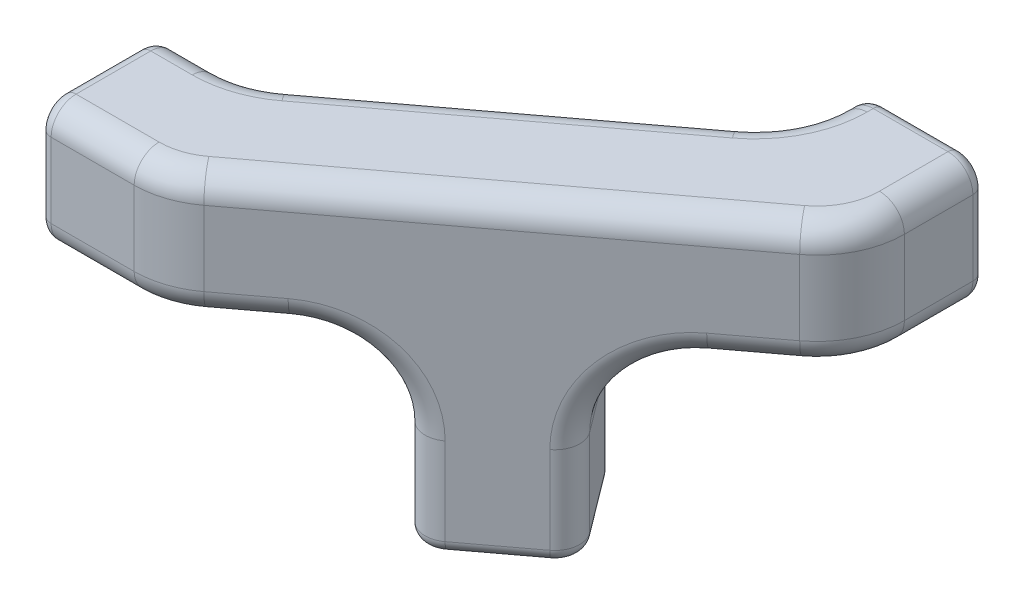
from build123d import *

# Parameters (mm, degrees)
BOSS_EXTRUDE1_DEPTH = 10
BOSS_EXTRUDE2_DEPTH = 15
SKETCH4_R           = 2.4999999999999942
CUT_EXTRUDE1_DEPTH  = 10
SKETCH5_R           = 2.4999999999999956
CUT_EXTRUDE2_DEPTH  = 10
SKETCH6_R           = 2.5000000000000093
CUT_EXTRUDE3_DEPTH  = 10
CHAMFER1_SIZE       = 0.7
FILLET1_R           = 7
FILLET2_R           = 1
FILLET3_R           = 2


with BuildPart() as part:
    # Sketch2 → Boss-Extrude1 (new body)
    with BuildSketch(Plane(origin=(0, 0, 0), x_dir=(1, 0, 0), z_dir=(0, 1, 0))):
        Polygon((-110.24999999999997, 168), (-103.5833333333333, 168), (-78.25, 187), (-78.25, 192), (-68.24999999999999, 192), (-68.24999999999999, 182), (-100.24999999999997, 158), (-110.24999999999997, 158), align=None)
    extrude(amount=BOSS_EXTRUDE1_DEPTH)

    # Sketch3 → Boss-Extrude2 (add)
    with BuildSketch(Plane.XZ):
        Polygon((-94.91666666666667, -174.5), (-88.91666666666667, -166.49999999999997), (-80.91666666666664, -172.50000000000003), (-86.91666666666663, -180.50000000000003), align=None)
    extrude(amount=BOSS_EXTRUDE2_DEPTH)

    # Sketch4 → Cut-Extrude1 (cut)
    with BuildSketch(Plane(origin=(0, 0, -192), x_dir=(-1, 0, 0), z_dir=(0, 0, -1))):
        with Locations((73.25, 5)):
            Circle(SKETCH4_R)
    extrude(amount=-CUT_EXTRUDE1_DEPTH, mode=Mode.SUBTRACT)

    # Sketch5 → Cut-Extrude2 (cut)
    with BuildSketch(Plane.ZY.offset(110.24999999999997)):
        with Locations((-163, 5)):
            Circle(SKETCH5_R)
    extrude(amount=-CUT_EXTRUDE2_DEPTH, mode=Mode.SUBTRACT)

    # Sketch6 → Cut-Extrude3 (cut)
    with BuildSketch(Plane.XZ.offset(15)):
        with Locations(Location((-87.91666666666666, -173.5, 0), (0, 0, 270))):
            Circle(SKETCH6_R)
    extrude(amount=-CUT_EXTRUDE3_DEPTH, mode=Mode.SUBTRACT)

    # Chamfer1
    chamfer1_edges = [part.edges().sort_by_distance(p)[0] for p in [
        (-70.75, 5, -192),
        (-110.24999999999997, 5, -165.5),
        (-87.91666666666666, -15, -171),
    ]]
    chamfer(chamfer1_edges, length=CHAMFER1_SIZE)

    # Fillet1
    fillet1_edges = [part.edges().sort_by_distance(p)[0] for p in [
        (-103.5833333333333, 5, -168),
        (-78.25, 5, -187),
        (-68.24999999999999, 5, -182),
        (-100.24999999999997, 5, -158),
        (-83.91666666666663, 0, -176.50000000000003),
        (-91.91666666666667, 0, -170.5),
    ]]
    fillet(fillet1_edges, radius=FILLET1_R)

    # Fillet2
    fillet2_edges = [part.edges().sort_by_distance(p)[0] for p in [
        (-110.24999999999997, 0, -163),
        (-110.24999999999997, 5, -168),
        (-78.25, 5, -192),
        (-68.24999999999999, 5, -192),
        (-110.24999999999997, 5, -158),
        (-73.25, 10, -192),
        (-90.91666666666666, -15, -177.5),
        (-83.91666666666663, -15, -176.50000000000003),
        (-84.91666666666666, -15, -169.5),
        (-91.91666666666667, -15, -170.5),
        (-110.24999999999997, 10, -163),
        (-73.25, 0, -192),
    ]]
    fillet(fillet2_edges, radius=FILLET2_R)

    # Fillet3
    # the kernel refuses this fillet: 2 mm, written as the material it takes off along each edge
    with BuildSketch(Plane(origin=(-110.24999999999997, 8, -166), x_dir=(0, 1, 0), z_dir=(0, 0, 1))) as fillet3_piece_1:
        with BuildLine():
            CenterArc((1, -1), 1, 0, 90)
            Line((2, -1), (2, 0))
            Line((2, 0), (1, 0))
        make_face()
    revolve(axis=Axis((-110.24999999999997, 8, -166), (-1, 0, 0)), revolution_arc=90, mode=Mode.SUBTRACT)
    with BuildSketch(Plane(origin=(-110.24999999999997, 2, -166), x_dir=(0, 0, -1), z_dir=(0, 1, 0))) as fillet3_piece_2:
        with BuildLine():
            CenterArc((1, -1), 1, 0, 90)
            Line((2, -1), (2, 0))
            Line((2, 0), (1, 0))
        make_face()
    revolve(axis=Axis((-110.24999999999997, 2, -166), (-1, 0, 0)), revolution_arc=90, mode=Mode.SUBTRACT)
    with BuildSketch(Plane(origin=(-110.24999999999997, 8, -160), x_dir=(0, 0, 1), z_dir=(0, -1, 0))) as fillet3_piece_3:
        with BuildLine():
            CenterArc((1, -1), 1, 0, 90)
            Line((2, -1), (2, 0))
            Line((2, 0), (1, 0))
        make_face()
    revolve(axis=Axis((-110.24999999999997, 8, -160), (-1, 0, 0)), revolution_arc=90, mode=Mode.SUBTRACT)
    with BuildSketch(Plane(origin=(-110.24999999999997, 1.9999999999999998, -160), x_dir=(0, -1, 0), z_dir=(0, 0, -1))) as fillet3_piece_4:
        with BuildLine():
            CenterArc((1, -1), 1, 0, 90)
            Line((2, -1), (2, 0))
            Line((2, 0), (1, 0))
        make_face()
    revolve(axis=Axis((-110.24999999999997, 1.9999999999999998, -160), (-1, 0, 0)), revolution_arc=90, mode=Mode.SUBTRACT)
    with BuildSketch(Plane(origin=(-76.25, 8, -192), x_dir=(-1, 0, 0), z_dir=(0, -1, 0))) as fillet3_piece_5:
        with BuildLine():
            CenterArc((1, -1), 1, 0, 90)
            Line((2, -1), (2, 0))
            Line((2, 0), (1, 0))
        make_face()
    revolve(axis=Axis((-76.25, 8, -192), (0, 0, -1)), revolution_arc=90, mode=Mode.SUBTRACT)
    with BuildSketch(Plane(origin=(-76.25, 1.9999999999999998, -192), x_dir=(0, -1, 0), z_dir=(1, 0, 0))) as fillet3_piece_6:
        with BuildLine():
            CenterArc((1, -1), 1, 0, 90)
            Line((2, -1), (2, 0))
            Line((2, 0), (1, 0))
        make_face()
    revolve(axis=Axis((-76.25, 1.9999999999999998, -192), (0, 0, -1)), revolution_arc=90, mode=Mode.SUBTRACT)
    with BuildSketch(Plane(origin=(-70.24999999999999, 8, -192), x_dir=(0, 1, 0), z_dir=(-1, 0, 0))) as fillet3_piece_7:
        with BuildLine():
            CenterArc((1, -1), 1, 0, 90)
            Line((2, -1), (2, 0))
            Line((2, 0), (1, 0))
        make_face()
    revolve(axis=Axis((-70.24999999999999, 8, -192), (0, 0, -1)), revolution_arc=90, mode=Mode.SUBTRACT)
    with BuildSketch(Plane(origin=(-70.24999999999999, 1.9999999999999998, -192), x_dir=(1, 0, 0), z_dir=(0, 1, 0))) as fillet3_piece_8:
        with BuildLine():
            CenterArc((1, -1), 1, 0, 90)
            Line((2, -1), (2, 0))
            Line((2, 0), (1, 0))
        make_face()
    revolve(axis=Axis((-70.24999999999999, 1.9999999999999998, -192), (0, 0, -1)), revolution_arc=90, mode=Mode.SUBTRACT)
    with BuildSketch(Plane(origin=(-87.31666666666665, -15, -177.70000000000002), x_dir=(-0.6000000000000005, 0, -0.7999999999999996), z_dir=(-0.7999999999999996, 0, 0.6000000000000005))) as fillet3_piece_9:
        with BuildLine():
            CenterArc((1, -1), 1, 0, 90)
            Line((2, -1), (2, 0))
            Line((2, 0), (1, 0))
        make_face()
    revolve(axis=Axis((-87.31666666666665, -15, -177.70000000000002), (0, -1, 0)), revolution_arc=90.00000000000011, mode=Mode.SUBTRACT)
    with BuildSketch(Plane(origin=(-92.11666666666667, -15, -174.1), x_dir=(-0.800000000000001, 0, 0.5999999999999986), z_dir=(0.5999999999999986, 0, 0.800000000000001))) as fillet3_piece_10:
        with BuildLine():
            CenterArc((1, -1), 1, 0, 90)
            Line((2, -1), (2, 0))
            Line((2, 0), (1, 0))
        make_face()
    revolve(axis=Axis((-92.11666666666667, -15, -174.1), (0, -1, 0)), revolution_arc=89.99999999999987, mode=Mode.SUBTRACT)
    with BuildSketch(Plane(origin=(-83.71666666666663, -15, -172.9), x_dir=(0.8000000000000007, 0, -0.5999999999999991), z_dir=(-0.5999999999999991, 0, -0.8000000000000007))) as fillet3_piece_11:
        with BuildLine():
            CenterArc((1, -1), 1, 0, 90)
            Line((2, -1), (2, 0))
            Line((2, 0), (1, 0))
        make_face()
    revolve(axis=Axis((-83.71666666666663, -15, -172.9), (0, -1, 0)), revolution_arc=89.99999999999993, mode=Mode.SUBTRACT)
    with BuildSketch(Plane(origin=(-88.51666666666665, -15, -169.29999999999998), x_dir=(0.6000000000000002, 0, 0.7999999999999999), z_dir=(0.7999999999999999, 0, -0.6000000000000002))) as fillet3_piece_12:
        with BuildLine():
            CenterArc((1, -1), 1, 0, 90)
            Line((2, -1), (2, 0))
            Line((2, 0), (1, 0))
        make_face()
    revolve(axis=Axis((-88.51666666666665, -15, -169.29999999999998), (0, -1, 0)), revolution_arc=90.00000000000011, mode=Mode.SUBTRACT)
    with BuildSketch(Plane(origin=(-102.5833333333333, 0, -158), x_dir=(0, 1, 0), z_dir=(-1, 0, 0))) as fillet3_piece_13:
        with BuildLine():
            CenterArc((FILLET3_R, FILLET3_R), FILLET3_R, 180, 90)
            Line((-2.2e-16, FILLET3_R), (0, 0))
            Line((0, 0), (FILLET3_R, 0))
        make_face()
    extrude(amount=7.666666666666671, mode=Mode.SUBTRACT)
    with BuildSketch(Plane(origin=(-102.5833333333333, 10, -158), x_dir=(0, -1, 0), z_dir=(-1, 0, 0))) as fillet3_piece_14:
        with BuildLine():
            CenterArc((FILLET3_R, -FILLET3_R), FILLET3_R, 90, 90)
            Line((0, -FILLET3_R), (0, 0))
            Line((0, 0), (FILLET3_R, 0))
        make_face()
    extrude(amount=7.666666666666671, mode=Mode.SUBTRACT)
    with BuildSketch(Plane(origin=(-78.25, 10, -190.5), x_dir=(1, 0, 0), z_dir=(0, 0, -1))) as fillet3_piece_15:
        with BuildLine():
            CenterArc((FILLET3_R, FILLET3_R), FILLET3_R, 180, 90)
            Line((0, FILLET3_R), (0, 0))
            Line((0, 0), (FILLET3_R, 0))
        make_face()
    extrude(amount=1.5, mode=Mode.SUBTRACT)
    with BuildSketch(Plane(origin=(-78.25, 0, -190.5), x_dir=(0, 1, 0), z_dir=(0, 0, -1))) as fillet3_piece_16:
        with BuildLine():
            CenterArc((FILLET3_R, FILLET3_R), FILLET3_R, 180, 90)
            Line((-2.2e-16, FILLET3_R), (0, 0))
            Line((0, 0), (FILLET3_R, 0))
        make_face()
    extrude(amount=1.5, mode=Mode.SUBTRACT)
    with BuildSketch(Plane(origin=(-88.91666666666667, -6.999999999999999, -166.49999999999997), x_dir=(0.8, 0, -0.6), z_dir=(0, -1, 0))) as fillet3_piece_17:
        with BuildLine():
            CenterArc((FILLET3_R, -FILLET3_R), FILLET3_R, 89.99999999999983, 89.99999999999969)
            Line((1.702e-14, -FILLET3_R), (0, 0))
            Line((0, 0), (FILLET3_R, -8e-17))
        make_face()
    extrude(amount=8, mode=Mode.SUBTRACT)
    with BuildSketch(Plane(origin=(-80.91666666666664, -6.999999999999999, -172.50000000000003), x_dir=(-0.7999999999999924, 0, 0.6000000000000103), z_dir=(0, -1, 0))) as fillet3_piece_18:
        with BuildLine():
            CenterArc((FILLET3_R, FILLET3_R), FILLET3_R, 180, 90.00000000000057)
            Line((-1.999e-14, FILLET3_R), (0, 0))
            Line((0, 0), (FILLET3_R, 1e-17))
        make_face()
    extrude(amount=8, mode=Mode.SUBTRACT)
    with BuildSketch(Plane(origin=(-94.91666666666667, -6.999999999999999, -174.5), x_dir=(0.8000000000000017, 0, -0.5999999999999978), z_dir=(0, -1, 0))) as fillet3_piece_19:
        with BuildLine():
            CenterArc((FILLET3_R, FILLET3_R), FILLET3_R, 180.00000000000023, 89.99999999999943)
            Line((-3e-17, FILLET3_R), (0, 0))
            Line((0, 0), (FILLET3_R, 1e-17))
        make_face()
    extrude(amount=8, mode=Mode.SUBTRACT)
    with BuildSketch(Plane(origin=(-86.91666666666663, -6.999999999999999, -180.50000000000003), x_dir=(-0.8, 0, 0.6), z_dir=(0, -1, 0))) as fillet3_piece_20:
        with BuildLine():
            CenterArc((FILLET3_R, -FILLET3_R), FILLET3_R, 89.99999999999983, 90.0000000000008)
            Line((1.131e-14, -FILLET3_R), (0, 0))
            Line((0, 0), (FILLET3_R, -8e-17))
        make_face()
    extrude(amount=8, mode=Mode.SUBTRACT)
    with BuildSketch(Plane(origin=(-68.24999999999999, 0, -192), x_dir=(0, 1, 0), z_dir=(0, 0, 1))) as fillet3_piece_21:
        with BuildLine():
            CenterArc((FILLET3_R, FILLET3_R), FILLET3_R, 180, 90)
            Line((-2.2e-16, FILLET3_R), (0, 0))
            Line((0, 0), (FILLET3_R, 0))
        make_face()
    extrude(amount=6.5, mode=Mode.SUBTRACT)
    with BuildSketch(Plane(origin=(-68.24999999999999, 10, -192), x_dir=(-1, 0, 0), z_dir=(0, 0, 1))) as fillet3_piece_22:
        with BuildLine():
            CenterArc((FILLET3_R, FILLET3_R), FILLET3_R, 180, 90)
            Line((0, FILLET3_R), (0, 0))
            Line((0, 0), (FILLET3_R, 0))
        make_face()
    extrude(amount=6.5, mode=Mode.SUBTRACT)
    with BuildSketch(Plane(origin=(-81.31666666666663, 0, -184.70000000000002), x_dir=(0, 1, 0), z_dir=(0.7999999999999996, 0, -0.6000000000000005))) as fillet3_piece_23:
        with BuildLine():
            CenterArc((FILLET3_R, FILLET3_R), FILLET3_R, 180, 90)
            Line((-2.2e-16, FILLET3_R), (0, 0))
            Line((0, 0), (FILLET3_R, 0))
        make_face()
    extrude(amount=0.333333333333303, mode=Mode.SUBTRACT)
    with BuildSketch(Plane(origin=(-71.04999999999998, 0, -179.9), x_dir=(2.56e-15, 1, 3.41e-15), z_dir=(-0.7999999999999999, 0, 0.6000000000000002))) as fillet3_piece_24:
        with BuildLine():
            CenterArc((FILLET3_R, FILLET3_R), FILLET3_R, 180, 90.00000000000023)
            Line((-8.75e-15, FILLET3_R), (0, 0))
            Line((0, 0), (FILLET3_R, 0))
        make_face()
    extrude(amount=5.333333333333315, mode=Mode.SUBTRACT)
    with BuildSketch(Plane(origin=(-75.24999999999999, 0, -185.5), x_dir=(0.6000000000000006, 0, 0.7999999999999995), z_dir=(-0.7999999999999995, 0, 0.6000000000000006))) as fillet3_piece_25:
        with BuildLine():
            CenterArc((6.999999999999997 - FILLET3_R, FILLET3_R), FILLET3_R, 270, 90)
            Line((6.999999999999997 - FILLET3_R, -2.2e-16), (6.999999999999997, 0))
            Line((6.999999999999997, 0), (6.999999999999997, FILLET3_R))
        make_face()
    revolve(axis=Axis((-75.24999999999999, 0, -185.5), (0, 1, 0)), revolution_arc=53.13010235415593, mode=Mode.SUBTRACT)
    with BuildSketch(Plane(origin=(-94.51666666666668, 0, -162.29999999999998), x_dir=(-0.6000000000000002, 0, -0.7999999999999998), z_dir=(-0.7999999999999999, 0, 0.6000000000000002))) as fillet3_piece_26:
        with BuildLine():
            CenterArc((FILLET3_R, -FILLET3_R), FILLET3_R, 90, 90)
            Line((0, -FILLET3_R), (0, 0))
            Line((0, 0), (FILLET3_R, 0))
        make_face()
    extrude(amount=4.833333333333281, mode=Mode.SUBTRACT)
    with BuildSketch(Plane(origin=(-71.04999999999998, 10, -179.9), x_dir=(-0.6000000000000002, 0, -0.7999999999999998), z_dir=(-0.7999999999999999, 0, 0.6000000000000002))) as fillet3_piece_27:
        with BuildLine():
            CenterArc((FILLET3_R, FILLET3_R), FILLET3_R, 180, 90)
            Line((-8.53e-15, FILLET3_R), (0, 0))
            Line((0, 0), (FILLET3_R, 0))
        make_face()
    extrude(amount=34.16666666666665, mode=Mode.SUBTRACT)
    with BuildSketch(Plane(origin=(-101.71666666666664, 10, -169.4), x_dir=(0.6000000000000005, 0, 0.7999999999999996), z_dir=(0.7999999999999996, 0, -0.6000000000000005))) as fillet3_piece_28:
        with BuildLine():
            CenterArc((FILLET3_R, FILLET3_R), FILLET3_R, 180, 90)
            Line((0, FILLET3_R), (0, 0))
            Line((0, 0), (FILLET3_R, 0))
        make_face()
    extrude(amount=25.833333333333314, mode=Mode.SUBTRACT)
    with BuildSketch(Plane(origin=(-110.24999999999997, 10, -168), x_dir=(0, 0, 1), z_dir=(1, 0, 0))) as fillet3_piece_29:
        with BuildLine():
            CenterArc((FILLET3_R, FILLET3_R), FILLET3_R, 180, 90)
            Line((0, FILLET3_R), (0, 0))
            Line((0, 0), (FILLET3_R, 0))
        make_face()
    extrude(amount=4.333333333333314, mode=Mode.SUBTRACT)
    with BuildSketch(Plane(origin=(-102.5833333333333, 10, -165), x_dir=(0, 0, 1), z_dir=(-1, 0, 0))) as fillet3_piece_30:
        with BuildLine():
            CenterArc((7 - FILLET3_R, -FILLET3_R), FILLET3_R, 0, 90)
            Line((7 - FILLET3_R, 0), (7, 0))
            Line((7, 0), (7, -FILLET3_R))
        make_face()
    revolve(axis=Axis((-102.5833333333333, 10, -165), (0, 1, 0)), revolution_arc=36.86989764584407, mode=Mode.SUBTRACT)
    with BuildSketch(Plane(origin=(-75.24999999999999, 10, -185.5), x_dir=(0.6000000000000006, 0, 0.7999999999999995), z_dir=(-0.7999999999999995, 0, 0.6000000000000006))) as fillet3_piece_31:
        with BuildLine():
            CenterArc((6.999999999999997 - FILLET3_R, -FILLET3_R), FILLET3_R, 0, 90)
            Line((6.999999999999997, -FILLET3_R), (6.999999999999997, 0))
            Line((6.999999999999997, 0), (6.999999999999997 - FILLET3_R, 0))
        make_face()
    revolve(axis=Axis((-75.24999999999999, 10, -185.5), (0, 1, 0)), revolution_arc=53.13010235415593, mode=Mode.SUBTRACT)
    with BuildSketch(Plane(origin=(-101.71666666666664, 0, -169.4), x_dir=(0.6000000000000005, 0, 0.7999999999999996), z_dir=(0.7999999999999996, 0, -0.6000000000000005))) as fillet3_piece_32:
        with BuildLine():
            CenterArc((FILLET3_R, -FILLET3_R), FILLET3_R, 90, 90)
            Line((0, -FILLET3_R), (0, 0))
            Line((0, 0), (FILLET3_R, 0))
        make_face()
    extrude(amount=1.499999999999966, mode=Mode.SUBTRACT)
    with BuildSketch(Plane(origin=(-110.24999999999997, 0, -168), x_dir=(0, 0, 1), z_dir=(1, 0, 0))) as fillet3_piece_33:
        with BuildLine():
            CenterArc((FILLET3_R, -FILLET3_R), FILLET3_R, 90, 90)
            Line((0, -FILLET3_R), (0, 0))
            Line((0, 0), (FILLET3_R, 0))
        make_face()
    extrude(amount=4.333333333333314, mode=Mode.SUBTRACT)
    with BuildSketch(Plane(origin=(-102.5833333333333, 0, -165), x_dir=(0, 0, 1), z_dir=(-1, 0, 0))) as fillet3_piece_34:
        with BuildLine():
            CenterArc((7 - FILLET3_R, FILLET3_R), FILLET3_R, 270, 90)
            Line((7, FILLET3_R), (7, 0))
            Line((7, 0), (7 - FILLET3_R, 0))
        make_face()
    revolve(axis=Axis((-102.5833333333333, 0, -165), (0, 1, 0)), revolution_arc=36.86989764584407, mode=Mode.SUBTRACT)
    with BuildSketch(Plane(origin=(-85.25, 0, -190.5), x_dir=(0.6000000000000006, 0, 0.7999999999999995), z_dir=(-0.7999999999999995, 0, 0.6000000000000006))) as fillet3_piece_35:
        with BuildLine():
            CenterArc((6.999999999999997 + FILLET3_R, FILLET3_R), FILLET3_R, 180, 90)
            Line((6.999999999999997 + FILLET3_R, -2.2e-16), (6.999999999999997, 0))
            Line((6.999999999999997, 0), (6.999999999999997, FILLET3_R))
        make_face()
    revolve(axis=Axis((-85.25, 0, -190.5), (0, 1, 0)), revolution_arc=53.13010235415593, mode=Mode.SUBTRACT)
    with BuildSketch(Plane(origin=(-85.25, 10, -190.5), x_dir=(0.6000000000000006, 0, 0.7999999999999995), z_dir=(-0.7999999999999995, 0, 0.6000000000000006))) as fillet3_piece_36:
        with BuildLine():
            CenterArc((6.999999999999997 + FILLET3_R, -FILLET3_R), FILLET3_R, 90, 90)
            Line((6.999999999999997, -FILLET3_R), (6.999999999999997, 0))
            Line((6.999999999999997, 0), (6.999999999999997 + FILLET3_R, 0))
        make_face()
    revolve(axis=Axis((-85.25, 10, -190.5), (0, 1, 0)), revolution_arc=53.13010235415593, mode=Mode.SUBTRACT)
    with BuildSketch(Plane(origin=(-105.91666666666666, 0, -175), x_dir=(0, 0, 1), z_dir=(-1, 0, 0))) as fillet3_piece_37:
        with BuildLine():
            CenterArc((7 + FILLET3_R, FILLET3_R), FILLET3_R, 180, 90)
            Line((7, FILLET3_R), (7, 0))
            Line((7, 0), (7 + FILLET3_R, 0))
        make_face()
    revolve(axis=Axis((-105.91666666666666, 0, -175), (0, 1, 0)), revolution_arc=36.86989764584416, mode=Mode.SUBTRACT)
    with BuildSketch(Plane(origin=(-105.91666666666666, 10, -175), x_dir=(0, 0, 1), z_dir=(-1, 0, 0))) as fillet3_piece_38:
        with BuildLine():
            CenterArc((7 + FILLET3_R, -FILLET3_R), FILLET3_R, 90, 90)
            Line((7, -FILLET3_R), (7, 0))
            Line((7, 0), (7 + FILLET3_R, 0))
        make_face()
    revolve(axis=Axis((-105.91666666666666, 10, -175), (0, 1, 0)), revolution_arc=36.86989764584416, mode=Mode.SUBTRACT)
    with BuildSketch(Plane(origin=(-100.51666666666665, -6.999999999999999, -170.29999999999995), x_dir=(0, 1, 0), z_dir=(-0.800000000000001, 0, 0.5999999999999986))) as fillet3_piece_39:
        with BuildLine():
            CenterArc((7 + FILLET3_R, -FILLET3_R), FILLET3_R, 90, 90)
            Line((7 + FILLET3_R, 0), (7, 0))
            Line((7, 0), (7, -FILLET3_R))
        make_face()
    revolve(axis=Axis((-100.51666666666665, -6.999999999999999, -170.29999999999995), (-0.5999999999999986, 0, -0.800000000000001)), revolution_arc=89.99999999999994, mode=Mode.SUBTRACT)
    with BuildSketch(Plane(origin=(-94.51666666666668, -6.999999999999999, -162.29999999999998), x_dir=(0, 1, 0), z_dir=(-0.800000000000001, 0, 0.5999999999999986))) as fillet3_piece_40:
        with BuildLine():
            CenterArc((7 + FILLET3_R, FILLET3_R), FILLET3_R, 180.00000000000088, 89.99999999999909)
            Line((7, FILLET3_R), (7, 0))
            Line((7, 0), (7 + FILLET3_R, 0))
        make_face()
    revolve(axis=Axis((-94.51666666666668, -6.999999999999999, -162.29999999999998), (-0.5999999999999986, 0, -0.800000000000001)), revolution_arc=90, mode=Mode.SUBTRACT)
    with BuildSketch(Plane(origin=(-75.31666666666663, -6.999999999999999, -176.70000000000002), x_dir=(-0.8000000000000013, 0, 0.5999999999999984), z_dir=(1e-16, -1, -8e-17))) as fillet3_piece_41:
        with BuildLine():
            CenterArc((7 + FILLET3_R, FILLET3_R), FILLET3_R, 179.99999999999827, 90.00000000000142)
            Line((7.000000000000004, FILLET3_R), (7, 1e-16))
            Line((7, 1e-16), (7 + FILLET3_R, -2.975e-14))
        make_face()
    revolve(axis=Axis((-75.31666666666663, -6.999999999999999, -176.70000000000002), (-0.5999999999999991, 0, -0.8000000000000007)), revolution_arc=90, mode=Mode.SUBTRACT)
    with BuildSketch(Plane(origin=(-81.3166666666666, -6.999999999999999, -184.7), x_dir=(-0.8000000000000013, 0, 0.5999999999999984), z_dir=(1e-16, -1, -8e-17))) as fillet3_piece_42:
        with BuildLine():
            CenterArc((7 + FILLET3_R, -FILLET3_R), FILLET3_R, 89.99999999999974, 90.0000000000008)
            Line((7.000000000000002, -FILLET3_R), (7, 1e-16))
            Line((7, 1e-16), (7 + FILLET3_R, 2.763e-14))
        make_face()
    revolve(axis=Axis((-81.3166666666666, -6.999999999999999, -184.7), (-0.5999999999999991, 0, -0.8000000000000007)), revolution_arc=89.99999999999994, mode=Mode.SUBTRACT)


solid = part.part
